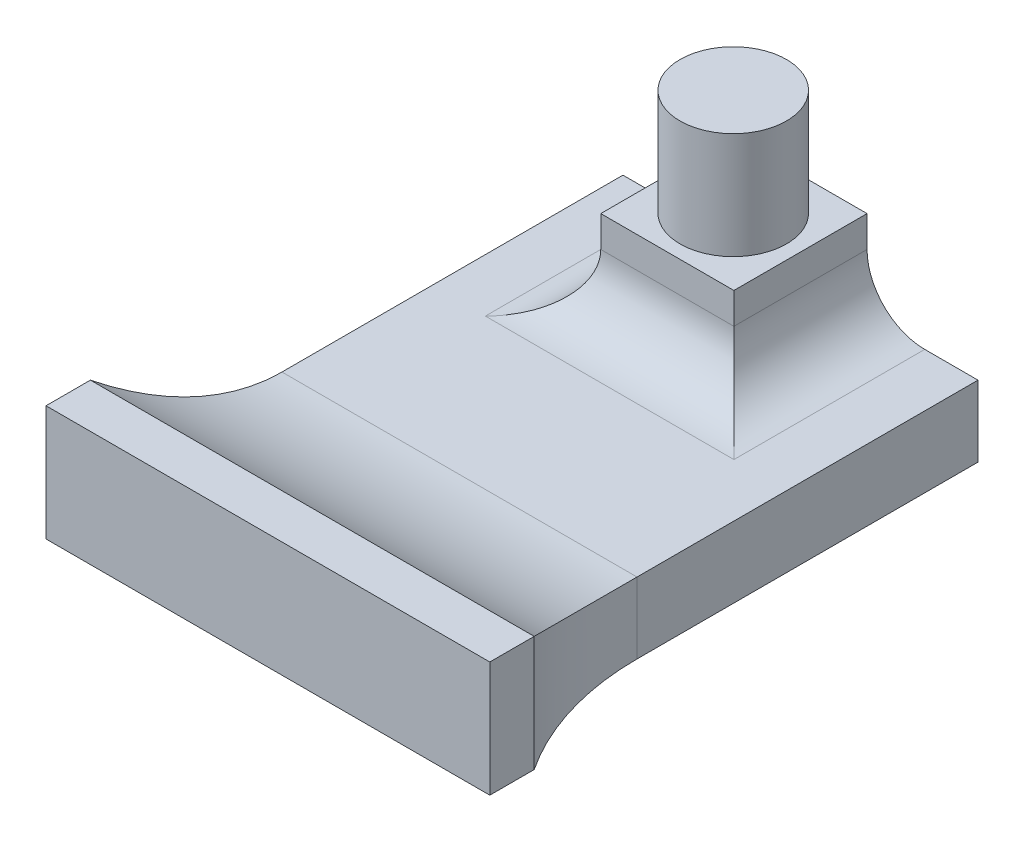
from build123d import *

# Parameters (mm, degrees)
SKETCH5_W           = 40
SKETCH5_H           = 10
BOSS_EXTRUDE4_DEPTH = 60
SKETCH11_W          = 15
SKETCH11_H          = 15
BOSS_EXTRUDE6_DEPTH = 10
FILLET1_R           = 6.5
SKETCH14_W          = 50
SKETCH14_H          = 15
BOSS_EXTRUDE7_DEPTH = 5
FILLET2_R           = 30
SKETCH16_R          = 6
BOSS_EXTRUDE8_DEPTH = 12
SKETCH17_W          = 64.115547938
SKETCH17_H          = 89.863494167
CUT_EXTRUDE1_DEPTH  = 2


with BuildPart() as part:
    # Sketch5 → Boss-Extrude4 (new body)
    with BuildSketch(Plane.XY):
        with Locations((-20, 5)):
            Rectangle(SKETCH5_W, SKETCH5_H)
    extrude(amount=BOSS_EXTRUDE4_DEPTH)

    # Sketch11 → Boss-Extrude6 (add)
    with BuildSketch(Plane(origin=(0, 10, 0), x_dir=(1, 0, 0), z_dir=(0, 1, 0))):
        with Locations((-20, -7.5)):
            Rectangle(SKETCH11_W, SKETCH11_H)
    extrude(amount=BOSS_EXTRUDE6_DEPTH)

    # Fillet1
    fillet1_edges = [part.edges().sort_by_distance(p)[0] for p in [
        (-27.5, 10, 7.5),
        (-20, 10, 15),
        (-12.5, 10, 7.5),
    ]]
    fillet(fillet1_edges, radius=FILLET1_R)

    # Sketch14 → Boss-Extrude7 (add)
    with BuildSketch(Plane.XY.offset(60)):
        with Locations((-20, 7.5)):
            Rectangle(SKETCH14_W, SKETCH14_H)
    extrude(amount=-BOSS_EXTRUDE7_DEPTH)

    # Fillet2
    # the kernel refuses this fillet: 30 mm, written as the material it adds along each edge
    with BuildSketch(Plane(origin=(0, 10, 55), x_dir=(0, 0, -1), z_dir=(0, -1, 0))) as fillet2_piece_1:
        with BuildLine():
            CenterArc((16.583123952, 30), FILLET2_R, 236.442690238, 33.557309762)
            Line((0, 5), (-0.331662479, 4.5))
            ThreePointArc((-0.331662479, 4.5), (-0.6, 2.5), (-0.6, 0))
            Line((-0.6, 0), (0, -0.6))
            Line((0, -0.6), (16.583123952, -0.6))
            Line((16.583123952, -0.6), (16.583123952, 0))
        make_face()
    extrude(amount=10)
    with BuildSketch(Plane(origin=(-40, 10, 55), x_dir=(0, 1, 0), z_dir=(1, 0, 0))) as fillet2_piece_2:
        with BuildLine():
            CenterArc((30, -16.583123952), FILLET2_R, 146.442690238, 33.557309762)
            Line((0, -16.583123952), (-0.6, -16.583123952))
            Line((-0.6, -16.583123952), (-0.6, 0))
            Line((-0.6, 0), (0, 0.6))
            ThreePointArc((0, 0.6), (2.5, 0.6), (4.5, 0.331662479))
            Line((4.5, 0.331662479), (5, 0))
        make_face()
    extrude(amount=40)
    with BuildSketch(Plane(origin=(-40, 0, 55), x_dir=(-1, 0, 0), z_dir=(0, 1, 0))) as fillet2_piece_3:
        with BuildLine():
            CenterArc((30, -16.583123952), FILLET2_R, 146.442690238, 33.557309762)
            Line((0, -16.583123952), (-0.6, -16.583123952))
            Line((-0.6, -16.583123952), (-0.6, 0))
            Line((-0.6, 0), (0, 0.6))
            ThreePointArc((0, 0.6), (2.5, 0.6), (4.5, 0.331662479))
            Line((4.5, 0.331662479), (5, 0))
        make_face()
    extrude(amount=10)
    with BuildSketch(Plane(origin=(0, 51.457809879, 55), x_dir=(0, 0, -1), z_dir=(0, -1, 0))) as fillet2_piece_4a_section:
        with BuildLine():
            CenterArc((16.583123952, 30), FILLET2_R, 236.442690238, 33.557309762)
            Line((0, 5), (-0.331662479, 4.5))
            ThreePointArc((-0.331662479, 4.5), (-0.6, 2.5), (-0.6, 0))
            Line((-0.6, 0), (0, -0.6))
            Line((0, -0.6), (16.583123952, -0.6))
            Line((16.583123952, -0.6), (16.583123952, 0))
        make_face()
    fillet2_piece_4a = extrude(amount=51.457809879, mode=Mode.PRIVATE)
    fillet2_piece_4a = split(fillet2_piece_4a, bisect_by=Plane(origin=(1.065152115, 10, 50.172088022), z_dir=(0, 1, 0)), keep=Keep.TOP, mode=Mode.PRIVATE)
    fillet2_piece_4a = split(fillet2_piece_4a, bisect_by=Plane(origin=(1.065152115, 15, 50.172088022), z_dir=(0, -1, 0)), keep=Keep.TOP, mode=Mode.PRIVATE)
    with BuildSketch(Plane(origin=(-40, 10, 55), x_dir=(0, 1, 0), z_dir=(1, 0, 0))) as fillet2_piece_4b_section:
        with BuildLine():
            CenterArc((30, -16.583123952), FILLET2_R, 146.442690238, 33.557309762)
            Line((0, -16.583123952), (-0.6, -16.583123952))
            Line((-0.6, -16.583123952), (-0.6, 0))
            Line((-0.6, 0), (0, 0.6))
            ThreePointArc((0, 0.6), (2.5, 0.6), (4.5, 0.331662479))
            Line((4.5, 0.331662479), (5, 0))
        make_face()
    fillet2_piece_4b = extrude(amount=81.457809879, mode=Mode.PRIVATE)
    fillet2_piece_4b = split(fillet2_piece_4b, bisect_by=Plane(origin=(0, 11.065152115, 50.172088022), z_dir=(1, 0, 0)), keep=Keep.TOP, mode=Mode.PRIVATE)
    fillet2_piece_4b = split(fillet2_piece_4b, bisect_by=Plane(origin=(5, 11.065152115, 50.172088022), z_dir=(-1, 0, 0)), keep=Keep.TOP, mode=Mode.PRIVATE)
    fillet2_piece_4 = fillet2_piece_4a & fillet2_piece_4b
    add(fillet2_piece_4)
    with BuildSketch(Plane(origin=(-81.457809879, 10, 55), x_dir=(0, 1, 0), z_dir=(1, 0, 0))) as fillet2_piece_5a_section:
        with BuildLine():
            CenterArc((30, -16.583123952), FILLET2_R, 146.442690238, 33.557309762)
            Line((0, -16.583123952), (-0.6, -16.583123952))
            Line((-0.6, -16.583123952), (-0.6, 0))
            Line((-0.6, 0), (0, 0.6))
            ThreePointArc((0, 0.6), (2.5, 0.6), (4.5, 0.331662479))
            Line((4.5, 0.331662479), (5, 0))
        make_face()
    fillet2_piece_5a = extrude(amount=81.457809879, mode=Mode.PRIVATE)
    fillet2_piece_5a = split(fillet2_piece_5a, bisect_by=Plane(origin=(-45, 11.065152115, 50.172088022), z_dir=(1, 0, 0)), keep=Keep.TOP, mode=Mode.PRIVATE)
    fillet2_piece_5a = split(fillet2_piece_5a, bisect_by=Plane(origin=(-40, 11.065152115, 50.172088022), z_dir=(-1, 0, 0)), keep=Keep.TOP, mode=Mode.PRIVATE)
    with BuildSketch(Plane(origin=(-40, 0, 55), x_dir=(-1, 0, 0), z_dir=(0, 1, 0))) as fillet2_piece_5b_section:
        with BuildLine():
            CenterArc((30, -16.583123952), FILLET2_R, 146.442690238, 33.557309762)
            Line((0, -16.583123952), (-0.6, -16.583123952))
            Line((-0.6, -16.583123952), (-0.6, 0))
            Line((-0.6, 0), (0, 0.6))
            ThreePointArc((0, 0.6), (2.5, 0.6), (4.5, 0.331662479))
            Line((4.5, 0.331662479), (5, 0))
        make_face()
    fillet2_piece_5b = extrude(amount=51.457809879, mode=Mode.PRIVATE)
    fillet2_piece_5b = split(fillet2_piece_5b, bisect_by=Plane(origin=(-41.065152115, 15, 50.172088022), z_dir=(0, -1, 0)), keep=Keep.TOP, mode=Mode.PRIVATE)
    fillet2_piece_5b = split(fillet2_piece_5b, bisect_by=Plane(origin=(-41.065152115, 10, 50.172088022), z_dir=(0, 1, 0)), keep=Keep.TOP, mode=Mode.PRIVATE)
    fillet2_piece_5 = fillet2_piece_5a & fillet2_piece_5b
    add(fillet2_piece_5)

    # Sketch16 → Boss-Extrude8 (add)
    with BuildSketch(Plane(origin=(0, 20, 0), x_dir=(1, 0, 0), z_dir=(0, 1, 0))):
        with Locations(Location((-20.072505657, -7.5, 0), (0, 0, 180))):
            Circle(SKETCH16_R)
    extrude(amount=BOSS_EXTRUDE8_DEPTH)

    # Sketch17 → Cut-Extrude1 (cut)
    with BuildSketch(Plane(origin=(0, 0, 0), x_dir=(-1, 0, 0), z_dir=(0, -1, 0))):
        with Locations((20.527974447, -24.438192458)):
            Rectangle(SKETCH17_W, SKETCH17_H)
    extrude(amount=-CUT_EXTRUDE1_DEPTH, mode=Mode.SUBTRACT)


solid = part.part
